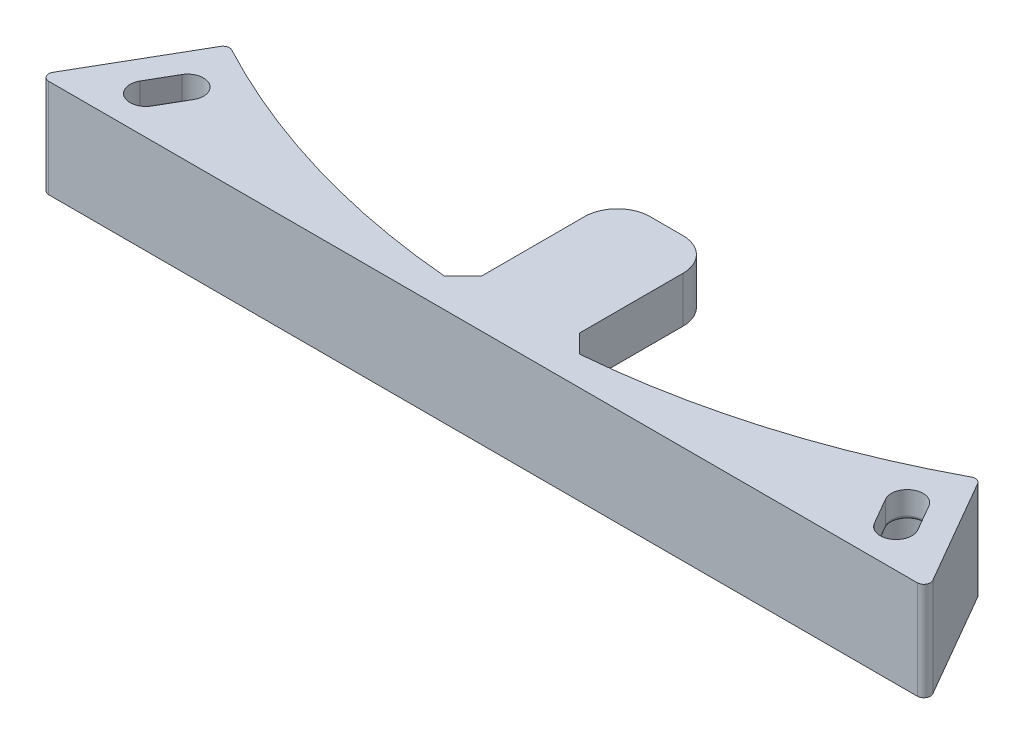
from build123d import *

# Parameters (mm, degrees)
BOSS_EXTRUDE1_DEPTH = 15
CUT_EXTRUDE1_DEPTH  = 143.214626533
CUT_EXTRUDE3_START  = -4
CUT_EXTRUDE3_DEPTH  = 139.214626533
FILLET1_R           = 1
FILLET2_R           = 0.5
SKETCH4_W           = 15
SKETCH4_H           = 28
BOSS_EXTRUDE2_DEPTH = 7
CHAMFER1_SIZE       = 3
FILLET3_R           = 5


with BuildPart() as part:
    # Sketch1 → Boss-Extrude1 (new body)
    with BuildSketch(Plane(origin=(0, 0, 0), x_dir=(1, 0, 0), z_dir=(0, 1, 0))):
        with BuildLine():
            Line((-57.286267839, -105.443271559), (-68, -124))
            Line((-68, -124), (68, -124))
            Line((68, -124), (57.286267839, -105.443271559))
            ThreePointArc((57.286267839, -105.443271559), (0, -120), (-57.286267839, -105.443271559))
        make_face()
    extrude(amount=BOSS_EXTRUDE1_DEPTH)

    # Sketch2 → Cut-Extrude1 (cut, through all)
    with BuildSketch(Plane(origin=(0, 15, 0), x_dir=(1, 0, 0), z_dir=(0, 1, 0))):
        with BuildLine():
            Line((-52.804159001, -115.380031326), (-55.129159001, -119.407049454))
            ThreePointArc((-55.129159001, -119.407049454), (-58.441770605, -120.294661058), (-59.32938221, -116.982049454))
            Line((-59.32938221, -116.982049454), (-57.00438221, -112.955031326))
            ThreePointArc((-57.00438221, -112.955031326), (-53.691770605, -112.067419722), (-52.804159001, -115.380031326))
        make_face()
        with BuildLine():
            Line((52.804159001, -115.380031326), (55.129159001, -119.407049454))
            ThreePointArc((55.129159001, -119.407049454), (58.441770605, -120.294661058), (59.32938221, -116.982049454))
            Line((59.32938221, -116.982049454), (57.00438221, -112.955031326))
            ThreePointArc((57.00438221, -112.955031326), (53.691770605, -112.067419722), (52.804159001, -115.380031326))
        make_face()
    extrude(amount=-CUT_EXTRUDE1_DEPTH, mode=Mode.SUBTRACT)

    # Sketch3 → Cut-Extrude3 (cut, through all)
    with BuildSketch(Plane(origin=(0, 15, 0), x_dir=(1, 0, 0), z_dir=(0, 1, 0)).offset(CUT_EXTRUDE3_START)):
        with BuildLine():
            Line((-51.019656288, -116.439181962), (-53.319656288, -120.422898819))
            ThreePointArc((-53.319656288, -120.422898819), (-59.466770605, -122.070013136), (-61.113884922, -115.922898819))
            Line((-61.113884922, -115.922898819), (-58.813884922, -111.939181962))
            ThreePointArc((-58.813884922, -111.939181962), (-52.666770605, -110.292067644), (-51.019656288, -116.439181962))
        make_face()
        with BuildLine():
            Line((51.019656288, -116.439181962), (53.319656288, -120.422898819))
            ThreePointArc((53.319656288, -120.422898819), (59.466770605, -122.070013136), (61.113884922, -115.922898819))
            Line((61.113884922, -115.922898819), (58.813884922, -111.939181962))
            ThreePointArc((58.813884922, -111.939181962), (52.666770605, -110.292067644), (51.019656288, -116.439181962))
        make_face()
    extrude(amount=-CUT_EXTRUDE3_DEPTH, mode=Mode.SUBTRACT)

    # Fillet1
    fillet1_edges = [part.edges().sort_by_distance(p)[0] for p in [
        (57.286267839, 7.5, 105.443271559),
        (68, 7.5, 124),
        (-68, 7.5, 124),
        (-57.286267839, 7.5, 105.443271559),
    ]]
    fillet(fillet1_edges, radius=FILLET1_R)

    # Fillet2
    fillet2_edges = [part.edges().sort_by_distance(p)[0] for p in [
        (-58.16688221, 11, 114.96854039),
        (53.966659001, 11, 117.39354039),
        (-52.666770605, 11, 110.292067644),
        (-59.963884922, 11, 113.93104039),
        (-59.466770605, 11, 122.070013136),
        (-52.169656288, 11, 118.43104039),
        (-53.691770605, 11, 112.067419722),
        (-53.966659001, 11, 117.39354039),
        (-58.441770605, 11, 120.294661058),
        (52.666770605, 11, 110.292067644),
        (52.169656288, 11, 118.43104039),
        (59.466770605, 11, 122.070013136),
        (59.963884922, 11, 113.93104039),
        (58.16688221, 11, 114.96854039),
        (53.691770605, 11, 112.067419722),
        (58.441770605, 11, 120.294661058),
    ]]
    fillet(fillet2_edges, radius=FILLET2_R)

    # Sketch4 → Boss-Extrude2 (add)
    with BuildSketch(Plane(origin=(0, 15, 0), x_dir=(1, 0, 0), z_dir=(0, 1, 0))):
        with Locations((0, -110)):
            Rectangle(SKETCH4_W, SKETCH4_H)
    extrude(amount=-BOSS_EXTRUDE2_DEPTH)

    # Chamfer1
    # the kernel refuses this chamfer: 3, 2.828734379 mm, written as the material it adds along each edge
    with BuildSketch(Plane(origin=(-7.5, 15, 119.76539567), x_dir=(0, 0, -1), z_dir=(0, -1, 0))) as chamfer1_piece_1:
        with BuildLine():
            Line((CHAMFER1_SIZE, 0), (0.207600012, -2.792399988))
            ThreePointArc((0.207600012, -2.792399988), (0.098564019, -1.43584929), (0, 0))
            Line((0, 0), (CHAMFER1_SIZE, 0))
        make_face()
    extrude(amount=7)
    with BuildSketch(Plane(origin=(7.5, 15, 119.76539567), x_dir=(0, 0, -1), z_dir=(0, -1, 0))) as chamfer1_piece_2:
        with BuildLine():
            Line((CHAMFER1_SIZE, 0), (0.207600012, 2.792399988))
            ThreePointArc((0.207600012, 2.792399988), (0.098564019, 1.43584929), (0, 0))
            Line((0, 0), (CHAMFER1_SIZE, 0))
        make_face()
    extrude(amount=7)

    # Fillet3
    fillet3_edges = [part.edges().sort_by_distance(p)[0] for p in [
        (7.5, 11.5, 96),
        (-7.5, 11.5, 96),
    ]]
    fillet(fillet3_edges, radius=FILLET3_R)


solid = part.part
